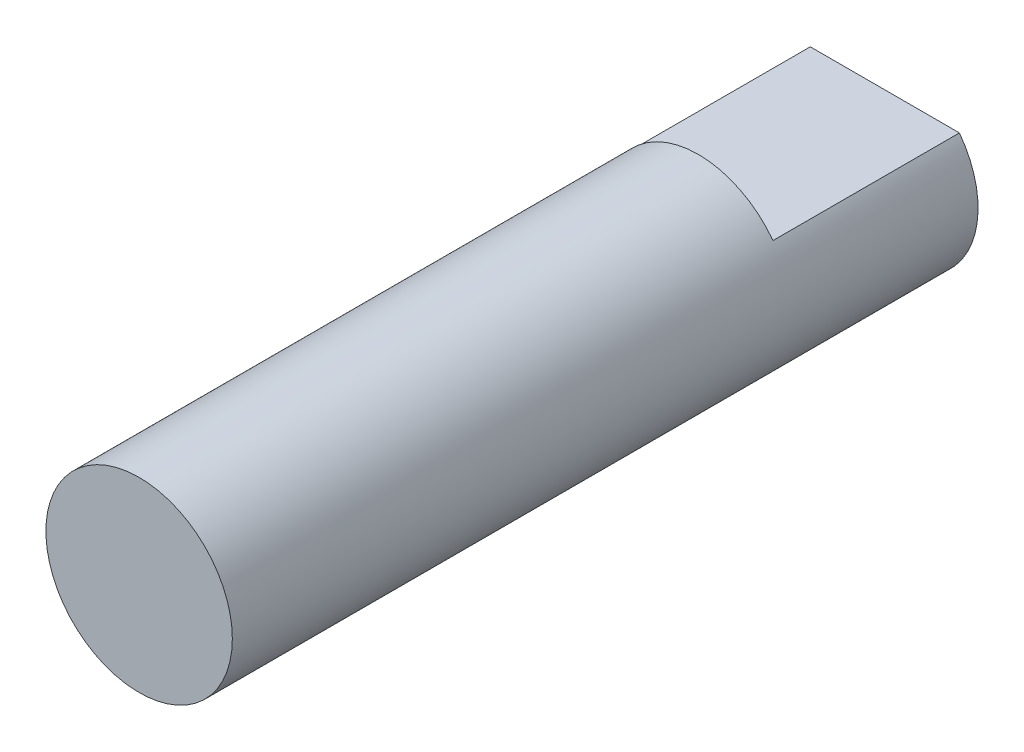
from build123d import *

# Parameters (mm, degrees)
SKETCH_1_R          = 5
EXTRUDE_1_DEPTH     = 40
CUT_EXTRUDE_1_DEPTH = 10


with BuildPart() as part:
    # 스케치1 → 보스-돌출1 (new body)
    with BuildSketch(Plane.XY):
        Circle(SKETCH_1_R)
    extrude(amount=EXTRUDE_1_DEPTH)

    # 스케치2 → 컷-돌출1 (cut)
    with BuildSketch(Plane.XY):
        with BuildLine():
            Line((-4, 3), (4, 3))
            ThreePointArc((4, 3), (0, 5), (-4, 3))
        make_face()
    extrude(amount=CUT_EXTRUDE_1_DEPTH, mode=Mode.SUBTRACT)


solid = part.part
